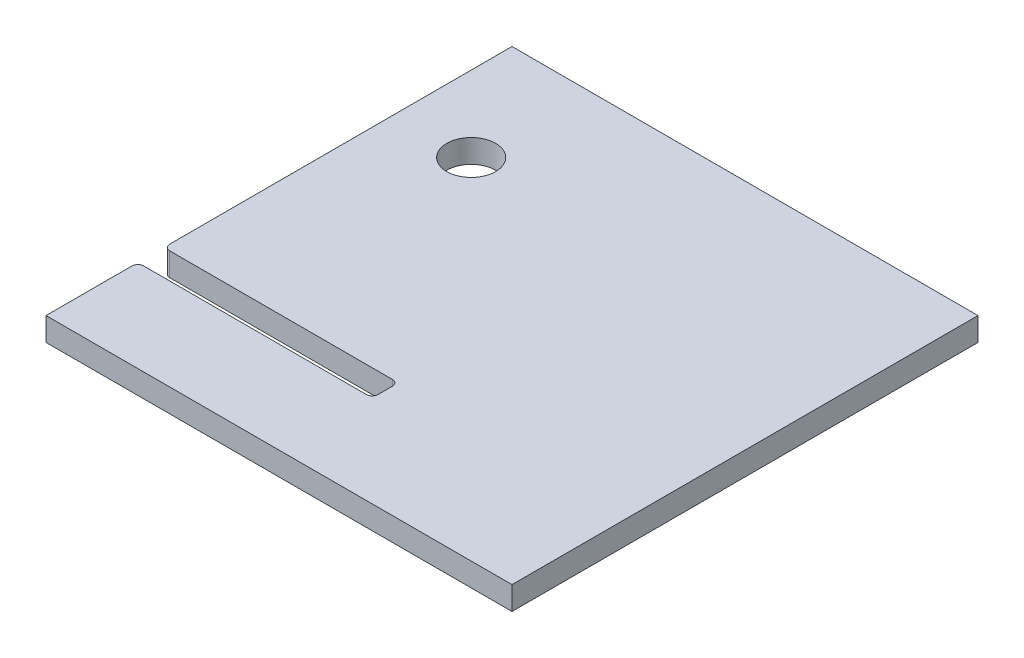
from build123d import *

# Parameters (mm, degrees)
SKETCH1_W               = 254
SKETCH1_H               = 254
BOSS_EXTRUDE1_DEPTH     = 6.35
CAVITY1_START           = -6.35
CAVITY1_OUTLINE_R       = 12.7
CAVITY1_DEPTH           = 12.7
CUT_EXTRUDE2_DEPTH      = 285.051619429
CUT_EXTRUDE2_DEPTH_BACK = 285.051619429
SKETCH3_W               = 127
SKETCH3_H               = 12.7
MOVE_FACE_SLOT_BY       = 0.762
MOVE_FACE_SLOT_2_BY     = 0.762
MOVE_FACE_SLOT_3_BY     = 0.762
FILLET1_R               = 3.175
MOVE_FACE_HOLE_BY       = 0.635


# Read off the part's stored shape, not the designer's step: Cavity1
with BuildPart() as part:
    # Sketch1 → Boss-Extrude1 (new, symmetric)
    with BuildSketch(Plane(origin=(0, 0, 0), x_dir=(1, 0, 0), z_dir=(0, 1, 0))):
        with Locations((0, 127)):
            Rectangle(SKETCH1_W, SKETCH1_H)
    extrude(amount=BOSS_EXTRUDE1_DEPTH, both=True)

    # Cavity1 outline → Cavity1 (cut)
    with BuildSketch(Plane(origin=(0, 0, 0), x_dir=(1, 0, 0), z_dir=(0, 1, 0)).offset(CAVITY1_START)):
        with Locations((-85.75, 190.5)):
            Circle(CAVITY1_OUTLINE_R)
    extrude(amount=CAVITY1_DEPTH, mode=Mode.SUBTRACT)

    # Sketch3 → Cut-Extrude2 (cut, two sides: drawn at the far end of the back side and taken through both)
    with BuildSketch(Plane(origin=(0, 0, 0), x_dir=(1, 0, 0), z_dir=(0, 1, 0)).offset(-CUT_EXTRUDE2_DEPTH_BACK)):
        with Locations((-63.5, 57.15)):
            Rectangle(SKETCH3_W, SKETCH3_H)
    extrude(amount=CUT_EXTRUDE2_DEPTH + CUT_EXTRUDE2_DEPTH_BACK, mode=Mode.SUBTRACT)

    # Move Face slot: a face moved inward by 0.762
    extrude(part.faces().sort_by_distance((0, 0, -57.15))[0], amount=MOVE_FACE_SLOT_BY, dir=(1, 0, 0), mode=Mode.SUBTRACT)

    # Move Face slot 2: a face moved inward by 0.762
    extrude(part.faces().sort_by_distance((-63.5, 0, -63.5))[0], amount=MOVE_FACE_SLOT_2_BY, dir=(0, 0, -1), mode=Mode.SUBTRACT)

    # Move Face slot 3: a face moved inward by 0.762
    extrude(part.faces().sort_by_distance((-63.5, 0, -50.8))[0], amount=MOVE_FACE_SLOT_3_BY, dir=(0, 0, 1), mode=Mode.SUBTRACT)

    # Fillet1
    fillet1_edges = [part.edges().sort_by_distance(p)[0] for p in [
        (-127, 0, -50.038),
        (-127, 0, -64.262),
        (0.762, 0, -64.262),
        (0.762, 0, -50.038),
    ]]
    fillet(fillet1_edges, radius=FILLET1_R)

    # Move Face hole: a curved face moved inward by 0.635
    add(Solid.thicken(part.faces().sort_by_distance((-98.45, 0, -190.5))[0], -MOVE_FACE_HOLE_BY), mode=Mode.SUBTRACT)


solid = part.part
